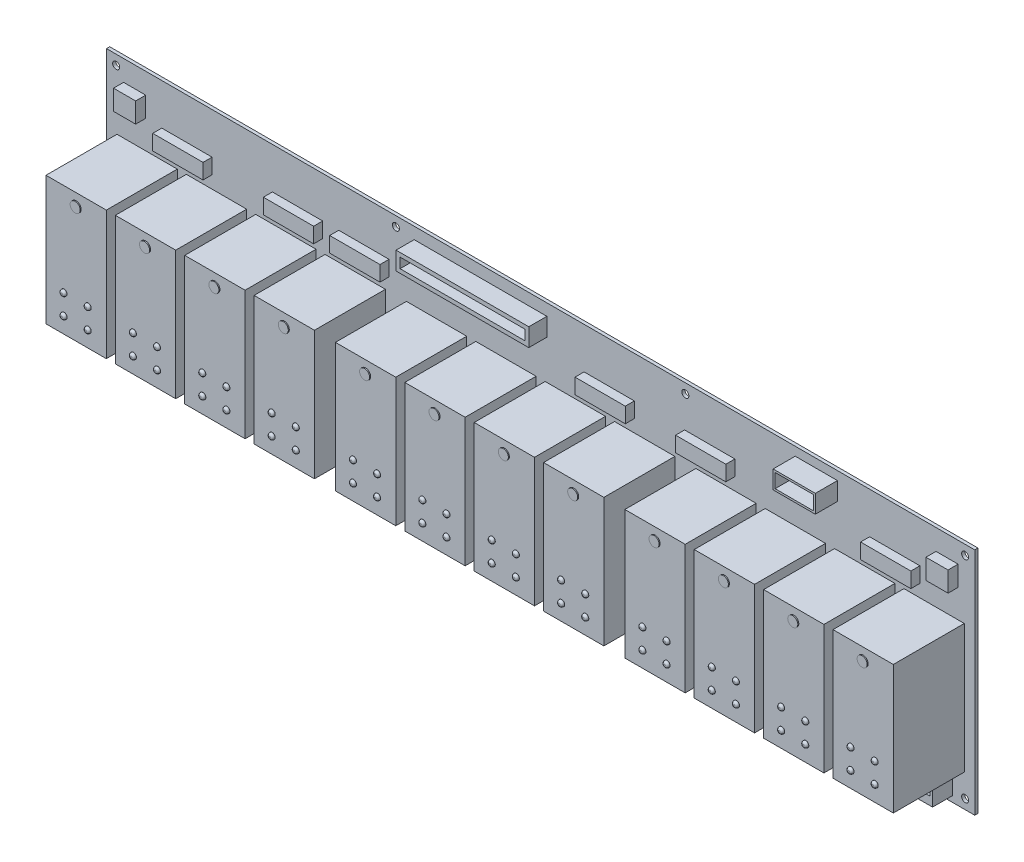
from build123d import *

# Parameters (mm, degrees)
SKETCH1_W        = 431.8
SKETCH1_H        = 114.3
PCB_DEPTH        = 1.6
SKETCH2_W        = 25
SKETCH2_H        = 7.6
BODY00_DEPTH     = 4.5
SKETCH3_W        = 11
SKETCH3_H        = 10
BODY01_DEPTH     = 5
SKETCH4_W        = 66
SKETCH4_H        = 9
BODY02_DEPTH     = 9
SKETCH5_W        = 121.92
SKETCH5_H        = 9
BODY03_DEPTH     = 10
SKETCH6_W        = 21
SKETCH6_H        = 9
BODY04_DEPTH     = 11
SKETCH7_W        = 30
SKETCH7_H        = 64
BODY05_DEPTH     = 35.3
SKETCH8_R        = 2.5
BODY06_DEPTH     = 0.5
SKETCH9_R        = 1.5
BODY07_DEPTH     = 1.2
SKETCH10_W       = 3.2
SKETCH10_H       = 3.2
CUT00_DEPTH      = 4
SKETCH11_W       = 62
SKETCH11_H       = 5
CUT01_DEPTH      = 7
SKETCH12_W       = 2.8
SKETCH12_H       = 2.8
CUT02_DEPTH      = 3
SKETCH13_W       = 19
SKETCH13_H       = 7
CUT03_DEPTH      = 8
SKETCH14_R       = 1.75
HOLES_DEPTH      = 1.6
ROUNDTOP0_R      = 1.1
ROUNDTOP0_FIX0_R = 1.1
ROUNDTOP0_FIX1_R = 1.1


with BuildPart() as part:
    # Sketch1 → PCB (new body)
    with BuildSketch(Plane.XY):
        with Locations((215.9, 57.15)):
            Rectangle(SKETCH1_W, SKETCH1_H)
    extrude(amount=PCB_DEPTH)

    # Sketch2 → Body00 (add)
    with BuildSketch(Plane.XY.offset(1.6)):
        with Locations((40, 90)):
            Rectangle(SKETCH2_W, SKETCH2_H)
        with Locations((95, 90)):
            Rectangle(SKETCH2_W, SKETCH2_H)
        with Locations((128, 90)):
            Rectangle(SKETCH2_W, SKETCH2_H)
        with Locations((250, 90)):
            Rectangle(SKETCH2_W, SKETCH2_H)
        with Locations((300, 90)):
            Rectangle(SKETCH2_W, SKETCH2_H)
        with Locations((392, 90)):
            Rectangle(SKETCH2_W, SKETCH2_H)
    extrude(amount=BODY00_DEPTH)

    # Sketch3 → Body01 (add)
    with BuildSketch(Plane.XY.offset(1.6)):
        with Locations((14, 99)):
            Rectangle(SKETCH3_W, SKETCH3_H)
        with Locations((418, 99)):
            Rectangle(SKETCH3_W, SKETCH3_H)
    extrude(amount=BODY01_DEPTH)

    # Sketch4 → Body02 (add)
    with BuildSketch(Plane.XY.offset(1.6)):
        with Locations((186, 104)):
            Rectangle(SKETCH4_W, SKETCH4_H)
    extrude(amount=BODY02_DEPTH)

    # Sketch5 → Body03 (add)
    with BuildSketch(Plane.XY.offset(1.6)):
        with Locations((71.967, 7.5)):
            Rectangle(SKETCH5_W, SKETCH5_H)
        with Locations((215.9, 7.5)):
            Rectangle(SKETCH5_W, SKETCH5_H)
        with Locations((359.833, 7.5)):
            Rectangle(SKETCH5_W, SKETCH5_H)
    extrude(amount=BODY03_DEPTH)

    # Sketch6 → Body04 (add)
    with BuildSketch(Plane.XY.offset(1.6)):
        with Locations((353, 105.5)):
            Rectangle(SKETCH6_W, SKETCH6_H)
    extrude(amount=BODY04_DEPTH)

    # Sketch7 → Body05 (add)
    with BuildSketch(Plane.XY.offset(1.6)):
        with Locations((20.217, 48)):
            Rectangle(SKETCH7_W, SKETCH7_H)
        with Locations((54.717, 48)):
            Rectangle(SKETCH7_W, SKETCH7_H)
        with Locations((89.217, 48)):
            Rectangle(SKETCH7_W, SKETCH7_H)
        with Locations((123.717, 48)):
            Rectangle(SKETCH7_W, SKETCH7_H)
        with Locations((164.15, 48)):
            Rectangle(SKETCH7_W, SKETCH7_H)
        with Locations((198.65, 48)):
            Rectangle(SKETCH7_W, SKETCH7_H)
        with Locations((233.15, 48)):
            Rectangle(SKETCH7_W, SKETCH7_H)
        with Locations((267.65, 48)):
            Rectangle(SKETCH7_W, SKETCH7_H)
        with Locations((308.083, 48)):
            Rectangle(SKETCH7_W, SKETCH7_H)
        with Locations((342.583, 48)):
            Rectangle(SKETCH7_W, SKETCH7_H)
        with Locations((377.083, 48)):
            Rectangle(SKETCH7_W, SKETCH7_H)
        with Locations((411.583, 48)):
            Rectangle(SKETCH7_W, SKETCH7_H)
    extrude(amount=BODY05_DEPTH)

    # Sketch8 → Body06 (add)
    with BuildSketch(Plane.XY.offset(36.9)):
        with Locations((20.217, 74)):
            Circle(SKETCH8_R)
        with Locations((54.717, 74)):
            Circle(SKETCH8_R)
        with Locations((89.217, 74)):
            Circle(SKETCH8_R)
        with Locations((123.717, 74)):
            Circle(SKETCH8_R)
        with Locations((164.15, 74)):
            Circle(SKETCH8_R)
        with Locations((198.65, 74)):
            Circle(SKETCH8_R)
        with Locations((233.15, 74)):
            Circle(SKETCH8_R)
        with Locations((267.65, 74)):
            Circle(SKETCH8_R)
        with Locations((308.083, 74)):
            Circle(SKETCH8_R)
        with Locations((342.583, 74)):
            Circle(SKETCH8_R)
        with Locations((377.083, 74)):
            Circle(SKETCH8_R)
        with Locations((411.583, 74)):
            Circle(SKETCH8_R)
    extrude(amount=BODY06_DEPTH)

    # Sketch9 → Body07 (add)
    with BuildSketch(Plane.XY.offset(36.9)):
        with Locations((14.217, 24)):
            Circle(SKETCH9_R)
        with Locations((14.217, 34)):
            Circle(SKETCH9_R)
        with Locations((26.217, 24)):
            Circle(SKETCH9_R)
        with Locations((26.217, 34)):
            Circle(SKETCH9_R)
        with Locations((48.717, 24)):
            Circle(SKETCH9_R)
        with Locations((48.717, 34)):
            Circle(SKETCH9_R)
        with Locations((60.717, 24)):
            Circle(SKETCH9_R)
        with Locations((60.717, 34)):
            Circle(SKETCH9_R)
        with Locations((83.217, 24)):
            Circle(SKETCH9_R)
        with Locations((83.217, 34)):
            Circle(SKETCH9_R)
        with Locations((95.217, 24)):
            Circle(SKETCH9_R)
        with Locations((95.217, 34)):
            Circle(SKETCH9_R)
        with Locations((117.717, 24)):
            Circle(SKETCH9_R)
        with Locations((117.717, 34)):
            Circle(SKETCH9_R)
        with Locations((129.717, 24)):
            Circle(SKETCH9_R)
        with Locations((129.717, 34)):
            Circle(SKETCH9_R)
        with Locations((158.15, 24)):
            Circle(SKETCH9_R)
        with Locations((158.15, 34)):
            Circle(SKETCH9_R)
        with Locations((170.15, 24)):
            Circle(SKETCH9_R)
        with Locations((170.15, 34)):
            Circle(SKETCH9_R)
        with Locations((192.65, 24)):
            Circle(SKETCH9_R)
        with Locations((192.65, 34)):
            Circle(SKETCH9_R)
        with Locations((204.65, 24)):
            Circle(SKETCH9_R)
        with Locations((204.65, 34)):
            Circle(SKETCH9_R)
        with Locations((227.15, 24)):
            Circle(SKETCH9_R)
        with Locations((227.15, 34)):
            Circle(SKETCH9_R)
        with Locations((239.15, 24)):
            Circle(SKETCH9_R)
        with Locations((239.15, 34)):
            Circle(SKETCH9_R)
        with Locations((261.65, 24)):
            Circle(SKETCH9_R)
        with Locations((261.65, 34)):
            Circle(SKETCH9_R)
        with Locations((273.65, 24)):
            Circle(SKETCH9_R)
        with Locations((273.65, 34)):
            Circle(SKETCH9_R)
        with Locations((302.083, 24)):
            Circle(SKETCH9_R)
        with Locations((302.083, 34)):
            Circle(SKETCH9_R)
        with Locations((314.083, 24)):
            Circle(SKETCH9_R)
        with Locations((314.083, 34)):
            Circle(SKETCH9_R)
        with Locations((336.583, 24)):
            Circle(SKETCH9_R)
        with Locations((336.583, 34)):
            Circle(SKETCH9_R)
        with Locations((348.583, 24)):
            Circle(SKETCH9_R)
        with Locations((348.583, 34)):
            Circle(SKETCH9_R)
        with Locations((371.083, 24)):
            Circle(SKETCH9_R)
        with Locations((371.083, 34)):
            Circle(SKETCH9_R)
        with Locations((383.083, 24)):
            Circle(SKETCH9_R)
        with Locations((383.083, 34)):
            Circle(SKETCH9_R)
        with Locations((405.583, 24)):
            Circle(SKETCH9_R)
        with Locations((405.583, 34)):
            Circle(SKETCH9_R)
        with Locations((417.583, 24)):
            Circle(SKETCH9_R)
        with Locations((417.583, 34)):
            Circle(SKETCH9_R)
    extrude(amount=BODY07_DEPTH)

    # Sketch10 → Cut00 (cut)
    with BuildSketch(Plane(origin=(0, 7, 0), x_dir=(1, 0, 0), z_dir=(0, 1, 0))):
        with Locations((13.547, -5.1)):
            Rectangle(SKETCH10_W, SKETCH10_H)
        with Locations((18.627, -5.1)):
            Rectangle(SKETCH10_W, SKETCH10_H)
        with Locations((23.707, -5.1)):
            Rectangle(SKETCH10_W, SKETCH10_H)
        with Locations((28.787, -5.1)):
            Rectangle(SKETCH10_W, SKETCH10_H)
        with Locations((33.867, -5.1)):
            Rectangle(SKETCH10_W, SKETCH10_H)
        with Locations((38.947, -5.1)):
            Rectangle(SKETCH10_W, SKETCH10_H)
        with Locations((44.027, -5.1)):
            Rectangle(SKETCH10_W, SKETCH10_H)
        with Locations((49.107, -5.1)):
            Rectangle(SKETCH10_W, SKETCH10_H)
        with Locations((54.187, -5.1)):
            Rectangle(SKETCH10_W, SKETCH10_H)
        with Locations((59.267, -5.1)):
            Rectangle(SKETCH10_W, SKETCH10_H)
        with Locations((64.347, -5.1)):
            Rectangle(SKETCH10_W, SKETCH10_H)
        with Locations((69.427, -5.1)):
            Rectangle(SKETCH10_W, SKETCH10_H)
        with Locations((74.507, -5.1)):
            Rectangle(SKETCH10_W, SKETCH10_H)
        with Locations((79.587, -5.1)):
            Rectangle(SKETCH10_W, SKETCH10_H)
        with Locations((84.667, -5.1)):
            Rectangle(SKETCH10_W, SKETCH10_H)
        with Locations((89.747, -5.1)):
            Rectangle(SKETCH10_W, SKETCH10_H)
        with Locations((94.827, -5.1)):
            Rectangle(SKETCH10_W, SKETCH10_H)
        with Locations((99.907, -5.1)):
            Rectangle(SKETCH10_W, SKETCH10_H)
        with Locations((104.987, -5.1)):
            Rectangle(SKETCH10_W, SKETCH10_H)
        with Locations((110.067, -5.1)):
            Rectangle(SKETCH10_W, SKETCH10_H)
        with Locations((115.147, -5.1)):
            Rectangle(SKETCH10_W, SKETCH10_H)
        with Locations((120.227, -5.1)):
            Rectangle(SKETCH10_W, SKETCH10_H)
        with Locations((125.307, -5.1)):
            Rectangle(SKETCH10_W, SKETCH10_H)
        with Locations((130.387, -5.1)):
            Rectangle(SKETCH10_W, SKETCH10_H)
        with Locations((157.48, -5.1)):
            Rectangle(SKETCH10_W, SKETCH10_H)
        with Locations((162.56, -5.1)):
            Rectangle(SKETCH10_W, SKETCH10_H)
        with Locations((167.64, -5.1)):
            Rectangle(SKETCH10_W, SKETCH10_H)
        with Locations((172.72, -5.1)):
            Rectangle(SKETCH10_W, SKETCH10_H)
        with Locations((177.8, -5.1)):
            Rectangle(SKETCH10_W, SKETCH10_H)
        with Locations((182.88, -5.1)):
            Rectangle(SKETCH10_W, SKETCH10_H)
        with Locations((187.96, -5.1)):
            Rectangle(SKETCH10_W, SKETCH10_H)
        with Locations((193.04, -5.1)):
            Rectangle(SKETCH10_W, SKETCH10_H)
        with Locations((198.12, -5.1)):
            Rectangle(SKETCH10_W, SKETCH10_H)
        with Locations((203.2, -5.1)):
            Rectangle(SKETCH10_W, SKETCH10_H)
        with Locations((208.28, -5.1)):
            Rectangle(SKETCH10_W, SKETCH10_H)
        with Locations((213.36, -5.1)):
            Rectangle(SKETCH10_W, SKETCH10_H)
        with Locations((218.44, -5.1)):
            Rectangle(SKETCH10_W, SKETCH10_H)
        with Locations((223.52, -5.1)):
            Rectangle(SKETCH10_W, SKETCH10_H)
        with Locations((228.6, -5.1)):
            Rectangle(SKETCH10_W, SKETCH10_H)
        with Locations((233.68, -5.1)):
            Rectangle(SKETCH10_W, SKETCH10_H)
        with Locations((238.76, -5.1)):
            Rectangle(SKETCH10_W, SKETCH10_H)
        with Locations((243.84, -5.1)):
            Rectangle(SKETCH10_W, SKETCH10_H)
        with Locations((248.92, -5.1)):
            Rectangle(SKETCH10_W, SKETCH10_H)
        with Locations((254, -5.1)):
            Rectangle(SKETCH10_W, SKETCH10_H)
        with Locations((259.08, -5.1)):
            Rectangle(SKETCH10_W, SKETCH10_H)
        with Locations((264.16, -5.1)):
            Rectangle(SKETCH10_W, SKETCH10_H)
        with Locations((269.24, -5.1)):
            Rectangle(SKETCH10_W, SKETCH10_H)
        with Locations((274.32, -5.1)):
            Rectangle(SKETCH10_W, SKETCH10_H)
        with Locations((301.413, -5.1)):
            Rectangle(SKETCH10_W, SKETCH10_H)
        with Locations((306.493, -5.1)):
            Rectangle(SKETCH10_W, SKETCH10_H)
        with Locations((311.573, -5.1)):
            Rectangle(SKETCH10_W, SKETCH10_H)
        with Locations((316.653, -5.1)):
            Rectangle(SKETCH10_W, SKETCH10_H)
        with Locations((321.733, -5.1)):
            Rectangle(SKETCH10_W, SKETCH10_H)
        with Locations((326.813, -5.1)):
            Rectangle(SKETCH10_W, SKETCH10_H)
        with Locations((331.893, -5.1)):
            Rectangle(SKETCH10_W, SKETCH10_H)
        with Locations((336.973, -5.1)):
            Rectangle(SKETCH10_W, SKETCH10_H)
        with Locations((342.053, -5.1)):
            Rectangle(SKETCH10_W, SKETCH10_H)
        with Locations((347.133, -5.1)):
            Rectangle(SKETCH10_W, SKETCH10_H)
        with Locations((352.213, -5.1)):
            Rectangle(SKETCH10_W, SKETCH10_H)
        with Locations((357.293, -5.1)):
            Rectangle(SKETCH10_W, SKETCH10_H)
        with Locations((362.373, -5.1)):
            Rectangle(SKETCH10_W, SKETCH10_H)
        with Locations((367.453, -5.1)):
            Rectangle(SKETCH10_W, SKETCH10_H)
        with Locations((372.533, -5.1)):
            Rectangle(SKETCH10_W, SKETCH10_H)
        with Locations((377.613, -5.1)):
            Rectangle(SKETCH10_W, SKETCH10_H)
        with Locations((382.693, -5.1)):
            Rectangle(SKETCH10_W, SKETCH10_H)
        with Locations((387.773, -5.1)):
            Rectangle(SKETCH10_W, SKETCH10_H)
        with Locations((392.853, -5.1)):
            Rectangle(SKETCH10_W, SKETCH10_H)
        with Locations((397.933, -5.1)):
            Rectangle(SKETCH10_W, SKETCH10_H)
        with Locations((403.013, -5.1)):
            Rectangle(SKETCH10_W, SKETCH10_H)
        with Locations((408.093, -5.1)):
            Rectangle(SKETCH10_W, SKETCH10_H)
        with Locations((413.173, -5.1)):
            Rectangle(SKETCH10_W, SKETCH10_H)
        with Locations((418.253, -5.1)):
            Rectangle(SKETCH10_W, SKETCH10_H)
    extrude(amount=-CUT00_DEPTH, mode=Mode.SUBTRACT)

    # Sketch11 → Cut01 (cut)
    with BuildSketch(Plane.XY.offset(10.6)):
        with Locations((186, 104)):
            Rectangle(SKETCH11_W, SKETCH11_H)
    extrude(amount=-CUT01_DEPTH, mode=Mode.SUBTRACT)

    # Sketch12 → Cut02 (cut)
    with BuildSketch(Plane.XY.offset(11.6)):
        with Locations((13.547, 8.5)):
            Rectangle(SKETCH12_W, SKETCH12_H)
        with Locations((18.627, 8.5)):
            Rectangle(SKETCH12_W, SKETCH12_H)
        with Locations((23.707, 8.5)):
            Rectangle(SKETCH12_W, SKETCH12_H)
        with Locations((28.787, 8.5)):
            Rectangle(SKETCH12_W, SKETCH12_H)
        with Locations((33.867, 8.5)):
            Rectangle(SKETCH12_W, SKETCH12_H)
        with Locations((38.947, 8.5)):
            Rectangle(SKETCH12_W, SKETCH12_H)
        with Locations((44.027, 8.5)):
            Rectangle(SKETCH12_W, SKETCH12_H)
        with Locations((49.107, 8.5)):
            Rectangle(SKETCH12_W, SKETCH12_H)
        with Locations((54.187, 8.5)):
            Rectangle(SKETCH12_W, SKETCH12_H)
        with Locations((59.267, 8.5)):
            Rectangle(SKETCH12_W, SKETCH12_H)
        with Locations((64.347, 8.5)):
            Rectangle(SKETCH12_W, SKETCH12_H)
        with Locations((69.427, 8.5)):
            Rectangle(SKETCH12_W, SKETCH12_H)
        with Locations((74.507, 8.5)):
            Rectangle(SKETCH12_W, SKETCH12_H)
        with Locations((79.587, 8.5)):
            Rectangle(SKETCH12_W, SKETCH12_H)
        with Locations((84.667, 8.5)):
            Rectangle(SKETCH12_W, SKETCH12_H)
        with Locations((89.747, 8.5)):
            Rectangle(SKETCH12_W, SKETCH12_H)
        with Locations((94.827, 8.5)):
            Rectangle(SKETCH12_W, SKETCH12_H)
        with Locations((99.907, 8.5)):
            Rectangle(SKETCH12_W, SKETCH12_H)
        with Locations((104.987, 8.5)):
            Rectangle(SKETCH12_W, SKETCH12_H)
        with Locations((110.067, 8.5)):
            Rectangle(SKETCH12_W, SKETCH12_H)
        with Locations((115.147, 8.5)):
            Rectangle(SKETCH12_W, SKETCH12_H)
        with Locations((120.227, 8.5)):
            Rectangle(SKETCH12_W, SKETCH12_H)
        with Locations((125.307, 8.5)):
            Rectangle(SKETCH12_W, SKETCH12_H)
        with Locations((130.387, 8.5)):
            Rectangle(SKETCH12_W, SKETCH12_H)
        with Locations((157.48, 8.5)):
            Rectangle(SKETCH12_W, SKETCH12_H)
        with Locations((162.56, 8.5)):
            Rectangle(SKETCH12_W, SKETCH12_H)
        with Locations((167.64, 8.5)):
            Rectangle(SKETCH12_W, SKETCH12_H)
        with Locations((172.72, 8.5)):
            Rectangle(SKETCH12_W, SKETCH12_H)
        with Locations((177.8, 8.5)):
            Rectangle(SKETCH12_W, SKETCH12_H)
        with Locations((182.88, 8.5)):
            Rectangle(SKETCH12_W, SKETCH12_H)
        with Locations((187.96, 8.5)):
            Rectangle(SKETCH12_W, SKETCH12_H)
        with Locations((193.04, 8.5)):
            Rectangle(SKETCH12_W, SKETCH12_H)
        with Locations((198.12, 8.5)):
            Rectangle(SKETCH12_W, SKETCH12_H)
        with Locations((203.2, 8.5)):
            Rectangle(SKETCH12_W, SKETCH12_H)
        with Locations((208.28, 8.5)):
            Rectangle(SKETCH12_W, SKETCH12_H)
        with Locations((213.36, 8.5)):
            Rectangle(SKETCH12_W, SKETCH12_H)
        with Locations((218.44, 8.5)):
            Rectangle(SKETCH12_W, SKETCH12_H)
        with Locations((223.52, 8.5)):
            Rectangle(SKETCH12_W, SKETCH12_H)
        with Locations((228.6, 8.5)):
            Rectangle(SKETCH12_W, SKETCH12_H)
        with Locations((233.68, 8.5)):
            Rectangle(SKETCH12_W, SKETCH12_H)
        with Locations((238.76, 8.5)):
            Rectangle(SKETCH12_W, SKETCH12_H)
        with Locations((243.84, 8.5)):
            Rectangle(SKETCH12_W, SKETCH12_H)
        with Locations((248.92, 8.5)):
            Rectangle(SKETCH12_W, SKETCH12_H)
        with Locations((254, 8.5)):
            Rectangle(SKETCH12_W, SKETCH12_H)
        with Locations((259.08, 8.5)):
            Rectangle(SKETCH12_W, SKETCH12_H)
        with Locations((264.16, 8.5)):
            Rectangle(SKETCH12_W, SKETCH12_H)
        with Locations((269.24, 8.5)):
            Rectangle(SKETCH12_W, SKETCH12_H)
        with Locations((274.32, 8.5)):
            Rectangle(SKETCH12_W, SKETCH12_H)
        with Locations((301.413, 8.5)):
            Rectangle(SKETCH12_W, SKETCH12_H)
        with Locations((306.493, 8.5)):
            Rectangle(SKETCH12_W, SKETCH12_H)
        with Locations((311.573, 8.5)):
            Rectangle(SKETCH12_W, SKETCH12_H)
        with Locations((316.653, 8.5)):
            Rectangle(SKETCH12_W, SKETCH12_H)
        with Locations((321.733, 8.5)):
            Rectangle(SKETCH12_W, SKETCH12_H)
        with Locations((326.813, 8.5)):
            Rectangle(SKETCH12_W, SKETCH12_H)
        with Locations((331.893, 8.5)):
            Rectangle(SKETCH12_W, SKETCH12_H)
        with Locations((336.973, 8.5)):
            Rectangle(SKETCH12_W, SKETCH12_H)
        with Locations((342.053, 8.5)):
            Rectangle(SKETCH12_W, SKETCH12_H)
        with Locations((347.133, 8.5)):
            Rectangle(SKETCH12_W, SKETCH12_H)
        with Locations((352.213, 8.5)):
            Rectangle(SKETCH12_W, SKETCH12_H)
        with Locations((357.293, 8.5)):
            Rectangle(SKETCH12_W, SKETCH12_H)
        with Locations((362.373, 8.5)):
            Rectangle(SKETCH12_W, SKETCH12_H)
        with Locations((367.453, 8.5)):
            Rectangle(SKETCH12_W, SKETCH12_H)
        with Locations((372.533, 8.5)):
            Rectangle(SKETCH12_W, SKETCH12_H)
        with Locations((377.613, 8.5)):
            Rectangle(SKETCH12_W, SKETCH12_H)
        with Locations((382.693, 8.5)):
            Rectangle(SKETCH12_W, SKETCH12_H)
        with Locations((387.773, 8.5)):
            Rectangle(SKETCH12_W, SKETCH12_H)
        with Locations((392.853, 8.5)):
            Rectangle(SKETCH12_W, SKETCH12_H)
        with Locations((397.933, 8.5)):
            Rectangle(SKETCH12_W, SKETCH12_H)
        with Locations((403.013, 8.5)):
            Rectangle(SKETCH12_W, SKETCH12_H)
        with Locations((408.093, 8.5)):
            Rectangle(SKETCH12_W, SKETCH12_H)
        with Locations((413.173, 8.5)):
            Rectangle(SKETCH12_W, SKETCH12_H)
        with Locations((418.253, 8.5)):
            Rectangle(SKETCH12_W, SKETCH12_H)
    extrude(amount=-CUT02_DEPTH, mode=Mode.SUBTRACT)

    # Sketch13 → Cut03 (cut)
    with BuildSketch(Plane.XY.offset(12.6)):
        with Locations((353, 105.5)):
            Rectangle(SKETCH13_W, SKETCH13_H)
    extrude(amount=-CUT03_DEPTH, mode=Mode.SUBTRACT)

    # Sketch14 → Holes (cut)
    with BuildSketch(Plane.XY.offset(1.6)):
        with Locations((4.8, 4.8)):
            Circle(SKETCH14_R)
        with Locations((4.8, 109.5)):
            Circle(SKETCH14_R)
        with Locations((143.933, 4.8)):
            Circle(SKETCH14_R)
        with Locations((143.933, 109.5)):
            Circle(SKETCH14_R)
        with Locations((287.867, 4.8)):
            Circle(SKETCH14_R)
        with Locations((287.867, 109.5)):
            Circle(SKETCH14_R)
        with Locations((427, 4.8)):
            Circle(SKETCH14_R)
        with Locations((427, 109.5)):
            Circle(SKETCH14_R)
    extrude(amount=-HOLES_DEPTH, mode=Mode.SUBTRACT)

    # RoundTop0
    roundtop0_edges = [part.edges().sort_by_distance(p)[0] for p in [
        (416.083, 34, 38.1),
        (416.083, 24, 38.1),
        (404.083, 34, 38.1),
        (404.083, 24, 38.1),
        (381.583, 34, 38.1),
        (381.583, 24, 38.1),
        (369.583, 34, 38.1),
        (369.583, 24, 38.1),
        (347.083, 34, 38.1),
        (347.083, 24, 38.1),
        (335.083, 34, 38.1),
        (335.083, 24, 38.1),
        (312.583, 34, 38.1),
        (312.583, 24, 38.1),
        (300.583, 34, 38.1),
        (300.583, 24, 38.1),
        (272.15, 34, 38.1),
        (272.15, 24, 38.1),
        (260.15, 34, 38.1),
        (260.15, 24, 38.1),
        (237.65, 24, 38.1),
        (225.65, 24, 38.1),
        (203.15, 34, 38.1),
        (203.15, 24, 38.1),
        (191.15, 34, 38.1),
        (191.15, 24, 38.1),
        (168.65, 34, 38.1),
        (168.65, 24, 38.1),
        (156.65, 34, 38.1),
        (156.65, 24, 38.1),
        (128.217, 34, 38.1),
        (128.217, 24, 38.1),
        (116.217, 34, 38.1),
        (116.217, 24, 38.1),
        (93.717, 34, 38.1),
        (93.717, 24, 38.1),
        (81.717, 34, 38.1),
        (81.717, 24, 38.1),
        (59.217, 34, 38.1),
        (59.217, 24, 38.1),
        (47.217, 34, 38.1),
        (47.217, 24, 38.1),
        (24.717, 34, 38.1),
        (24.717, 24, 38.1),
        (12.717, 34, 38.1),
        (12.717, 24, 38.1),
    ]]
    fillet(roundtop0_edges, radius=ROUNDTOP0_R)

    # RoundTop0_fix0
    roundtop0_fix0_edges = [part.edges().sort_by_distance(p)[0] for p in [
        (225.65, 34, 38.1),
    ]]
    fillet(roundtop0_fix0_edges, radius=ROUNDTOP0_FIX0_R)

    # RoundTop0_fix1
    roundtop0_fix1_edges = [part.edges().sort_by_distance(p)[0] for p in [
        (237.65, 34, 38.1),
    ]]
    fillet(roundtop0_fix1_edges, radius=ROUNDTOP0_FIX1_R)


solid = part.part
